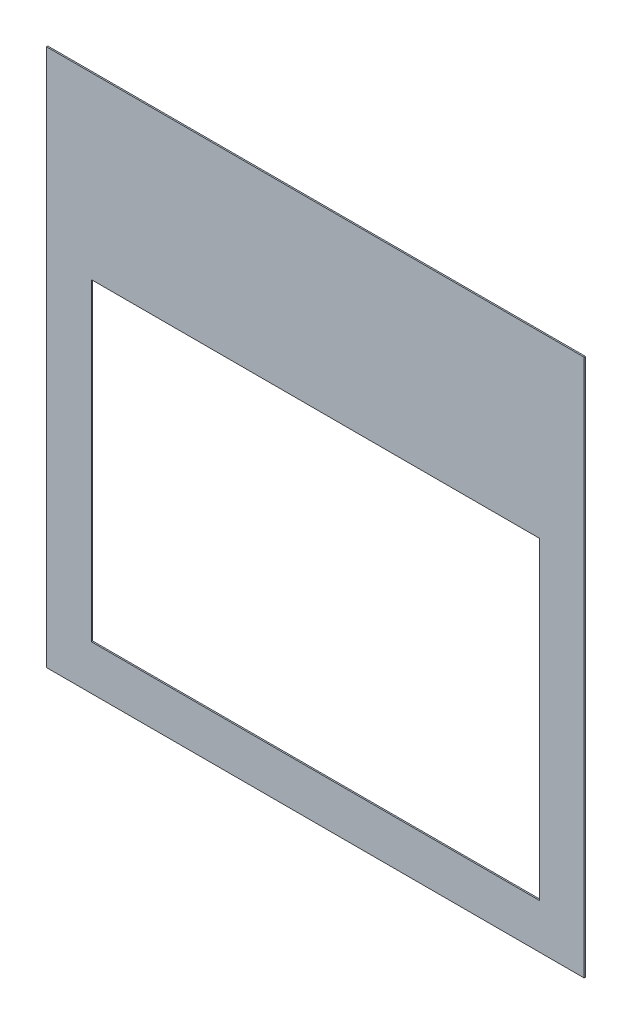
from build123d import *

# Parameters (mm, degrees)
SKETCH1_W          = 1200
SKETCH1_H          = 1200
SKETCH1_W_2        = 1000
SKETCH1_H_2        = 700
BASE_FLANGE1_DEPTH = 3


# Sheet-metal steps are written as plain solids
with BuildPart() as part:
    # Sketch1 → Base-Flange1 (new body)
    with BuildSketch(Plane.XY):
        with Locations((0, -600)):
            Rectangle(SKETCH1_W, SKETCH1_H)
        with Locations((0, -750)):
            Rectangle(SKETCH1_W_2, SKETCH1_H_2, mode=Mode.SUBTRACT)
    extrude(amount=-BASE_FLANGE1_DEPTH)


solid = part.part
